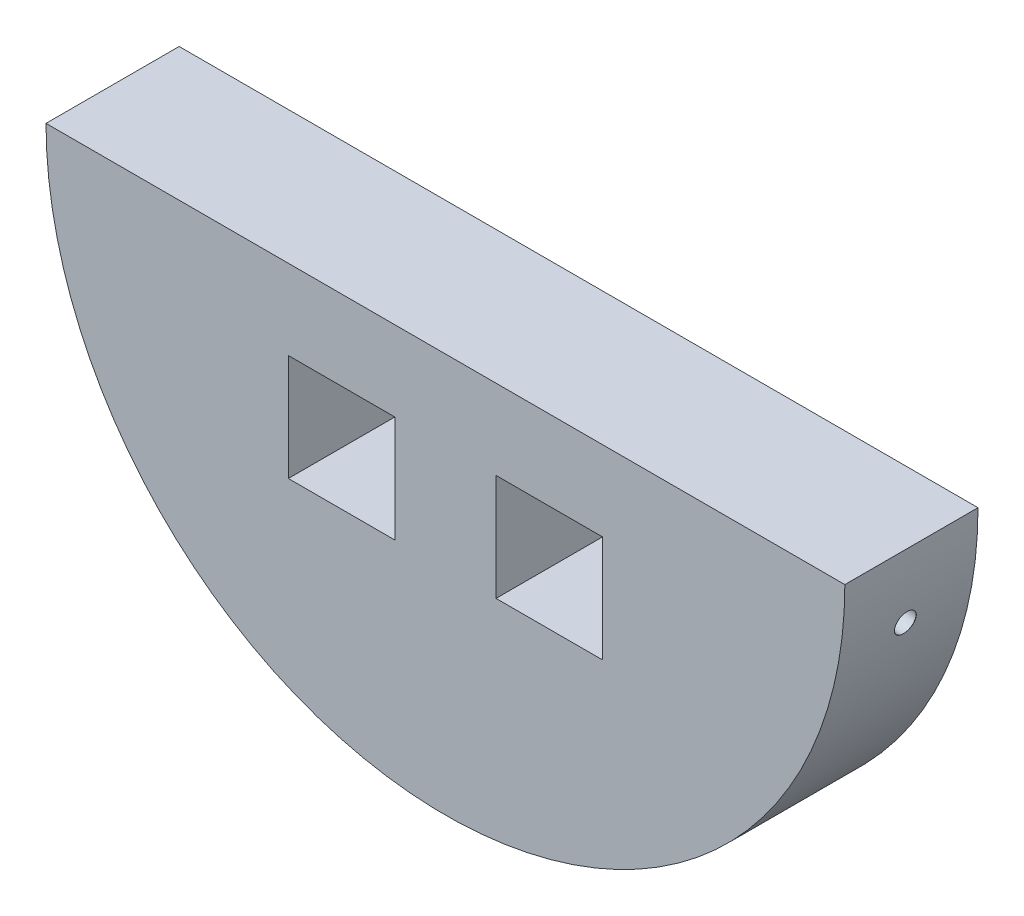
from build123d import *
from OCP.BRepFilletAPI import BRepFilletAPI_MakeChamfer

# Parameters (mm, degrees)
SKETCH1_W           = 20
SKETCH1_H           = 20
BOSS_EXTRUDE1_DEPTH = 25
CIRPATTERN1_COUNT   = 5
CIRPATTERN1_ANGLE   = 160
CHAMFER1_SIZE       = 15
CHAMFER1_SIZE2      = 8.660254038


with BuildPart() as part:
    # Sketch1 → Boss-Extrude1 (new body)
    with BuildSketch(Plane.XY):
        with BuildLine():
            Line((-150, 0), (0, 0))
            ThreePointArc((0, 0), (-75, -75), (-150, 0))
        make_face()
        with Locations((-55.5, -25)):
            Rectangle(SKETCH1_W, SKETCH1_H, mode=Mode.SUBTRACT)
        with Locations((-94.5, -25)):
            Rectangle(SKETCH1_W, SKETCH1_H, mode=Mode.SUBTRACT)
    extrude(amount=BOSS_EXTRUDE1_DEPTH)

    # Sketch4 → Ø4.0mm Dowel Hole2 (revolve, cut)
    with BuildSketch(Plane(origin=(-1.139418524, -13.023613325, 12.5), x_dir=(0.17364817766693047, 0.9848077530122081, 0), z_dir=(0, 0, 1))):
        Polygon((0, 0), (0, 17.201721238), (2, 16), (2, 0.025), (2.025, 0), align=None)
    f_4_0mm_dowel_hole2 = revolve(axis=Axis((5.114110708, -14.126279253, 12.5), (-0.9848077530122081, 0.17364817766693044, 0)), mode=Mode.SUBTRACT)

    # CirPattern1: Ø4.0mm Dowel Hole2 ×5 about axis
    cirpattern1_axis = Axis((-75, 0, 0), (0, 0, -1))
    for i in range(1, CIRPATTERN1_COUNT):
        add(f_4_0mm_dowel_hole2.rotate(cirpattern1_axis, i * CIRPATTERN1_ANGLE / (CIRPATTERN1_COUNT - 1)), mode=Mode.SUBTRACT)

    # Chamfer1: one chamfer whose edges measure the first distance from different faces: ONE call of the kernel's chamfer builder (chamfer() names one face for all edges)
    chamfer1_edges_1 = [part.edges().sort_by_distance(p)[0] for p in [
        (-94.5, -15, 0),
    ]]
    chamfer1_side_1 = [part.faces().sort_by_distance(p)[0] for p in [
        (-94.5, -15, 12.5),
    ]]
    chamfer1_edges_2 = [part.edges().sort_by_distance(p)[0] for p in [
        (-55.5, -15, 0),
    ]]
    chamfer1_side_2 = [part.faces().sort_by_distance(p)[0] for p in [
        (-55.5, -15, 12.5),
    ]]
    chamfer1 = BRepFilletAPI_MakeChamfer(part.part.solid().wrapped)
    for e in chamfer1_edges_1:
        chamfer1.Add(CHAMFER1_SIZE, CHAMFER1_SIZE2, e.wrapped, chamfer1_side_1[0].wrapped)  # the first distance lies on this face
    for e in chamfer1_edges_2:
        chamfer1.Add(CHAMFER1_SIZE, CHAMFER1_SIZE2, e.wrapped, chamfer1_side_2[0].wrapped)  # the first distance lies on this face
    add(Compound.cast(chamfer1.Shape()), mode=Mode.REPLACE)


solid = part.part
